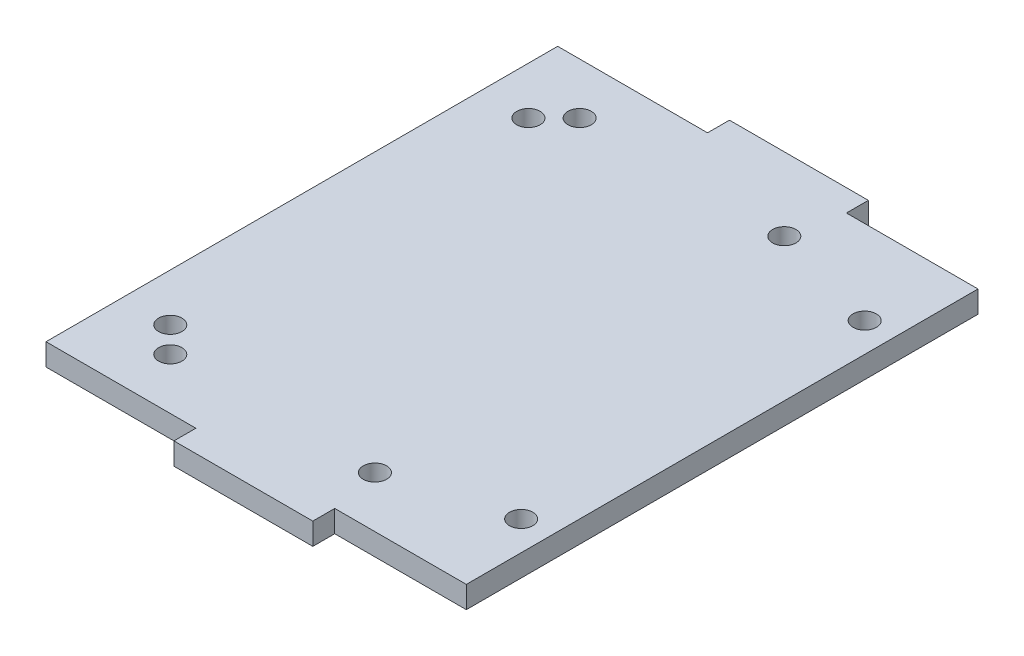
from build123d import *

# Parameters (mm, degrees)
SKETCH1_R           = 1.6
BOSS_EXTRUDE1_DEPTH = 3


with BuildPart() as part:
    # Sketch1 → Boss-Extrude1 (new body)
    with BuildSketch(Plane(origin=(0, 0, 0), x_dir=(1, 0, 0), z_dir=(0, 1, 0))):
        Polygon((61, -35), (63.79786164, -35), (63.79786164, 35), (61, 35), (45.79786164, 35), (45.79786164, 38), (26.79786164, 38), (26.79786164, 35), (8.79786164, 35), (6.29786164, 35), (6.29786164, -35), (8.79786164, -35), (26.79786164, -35), (26.79786164, -38), (45.79786164, -38), (45.79786164, -35), align=None)
        with Locations((12.79786164, -24.5)):
            Circle(SKETCH1_R, mode=Mode.SUBTRACT)
        with Locations((16.29786164, -28)):
            Circle(SKETCH1_R, mode=Mode.SUBTRACT)
        with Locations((44.29786164, -28)):
            Circle(SKETCH1_R, mode=Mode.SUBTRACT)
        with Locations((59.79786164, -23.5)):
            Circle(SKETCH1_R, mode=Mode.SUBTRACT)
        with Locations((12.79786164, 24.5)):
            Circle(SKETCH1_R, mode=Mode.SUBTRACT)
        with Locations((16.29786164, 28)):
            Circle(SKETCH1_R, mode=Mode.SUBTRACT)
        with Locations((44.29786164, 28)):
            Circle(SKETCH1_R, mode=Mode.SUBTRACT)
        with Locations((59.79786164, 23.5)):
            Circle(SKETCH1_R, mode=Mode.SUBTRACT)
    extrude(amount=BOSS_EXTRUDE1_DEPTH)


solid = part.part
